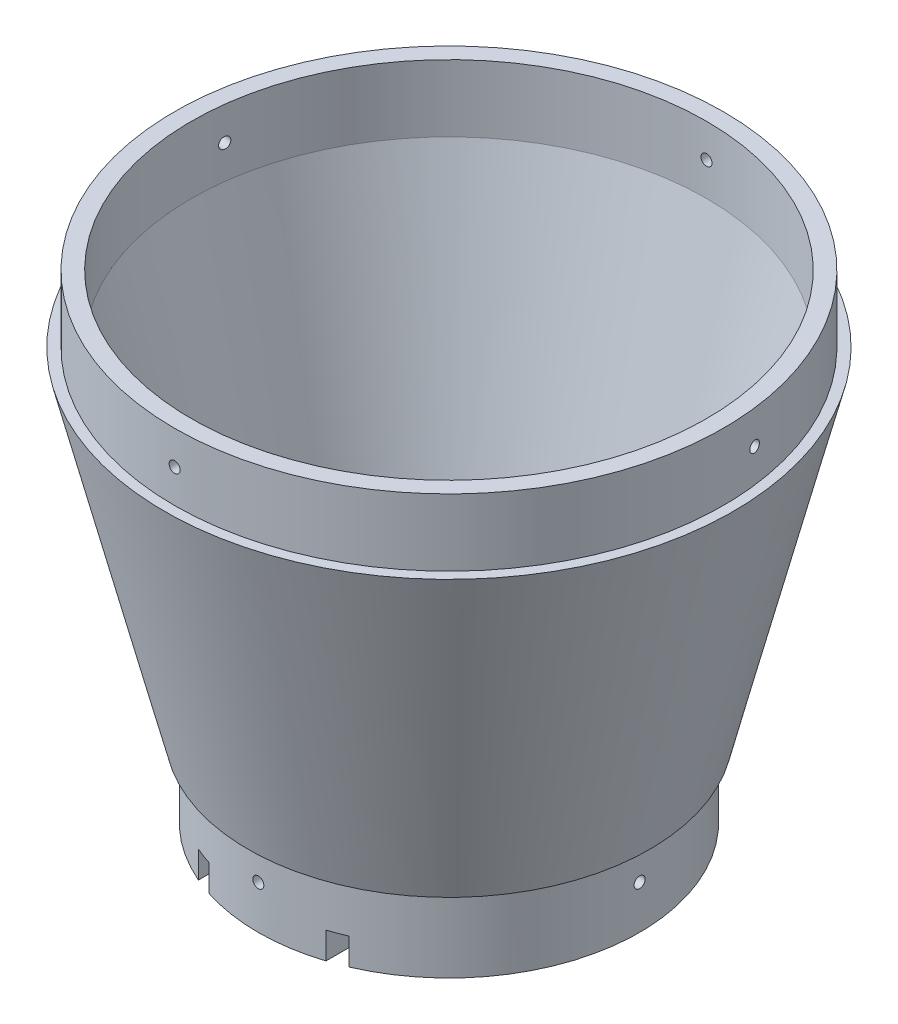
from build123d import *

# Parameters (mm, degrees)
BOSS_EXTRUDE1_REACH             = 171.853
SKETCH3_W                       = 15
SKETCH3_H                       = 10
BOSS_EXTRUDE1_DIRECTION_2_REACH = 171.853
CUT_EXTRUDE1_DEPTH              = 170.852877515
CUT_EXTRUDE1_DEPTH_BACK         = 170.852877515
SKETCH4_W                       = 5
SKETCH4_H                       = 8
M4_TAPPED_HOLE1_REACH           = 235.236
M4_TAPPED_HOLE1_BORE_R          = 1.65
M4_TAPPED_HOLE1_ON_FACE_2_REACH = 231.789
M4_TAPPED_HOLE1_BORE_2_R        = 1.65
M4_TAPPED_HOLE1_ON_FACE_3_REACH = 235.236
M4_TAPPED_HOLE1_BORE_3_R        = 1.65
M4_TAPPED_HOLE1_ON_FACE_4_REACH = 212.45
M4_TAPPED_HOLE1_BORE_4_R        = 1.65
M4_TAPPED_HOLE1_ON_FACE_5_REACH = 212.45
M4_TAPPED_HOLE1_BORE_5_R        = 1.65
M4_TAPPED_HOLE1_ON_FACE_6_REACH = 212.45
M4_TAPPED_HOLE1_BORE_6_R        = 1.65
M4_TAPPED_HOLE1_ON_FACE_7_REACH = 212.45
M4_TAPPED_HOLE1_BORE_7_R        = 1.65
M4_TAPPED_HOLE1_ON_FACE_8_REACH = 231.789
M4_TAPPED_HOLE1_BORE_8_R        = 1.65


with BuildPart() as part:
    # Sketch1 → Revolve1 (revolve)
    with BuildSketch(Plane.XY):
        Polygon((77, 120), (82, 120), (82, 100), (85, 100), (60, 0), (57, 0), (57, -23), (52, -23), (52, 0), (77, 100), align=None)
    revolve(axis=Axis((0, 0, 0), (0, 1, 0)))

    # Sketch3 → Boss-Extrude1 (add, up to next)
    with BuildSketch(Plane.XY, mode=Mode.PRIVATE) as boss_extrude1_sk1:
        with Locations((20, -18)):
            Rectangle(SKETCH3_W, SKETCH3_H)
    boss_extrude1_tool1 = extrude(boss_extrude1_sk1.sketch, amount=BOSS_EXTRUDE1_REACH, mode=Mode.PRIVATE) - part.part
    # Sketch3 → Boss-Extrude1 (add, up to next)
    with BuildSketch(Plane.XY, mode=Mode.PRIVATE) as boss_extrude1_sk2:
        with Locations((-20, -18)):
            Rectangle(SKETCH3_W, SKETCH3_H)
    boss_extrude1_tool2 = extrude(boss_extrude1_sk2.sketch, amount=BOSS_EXTRUDE1_REACH, mode=Mode.PRIVATE) - part.part
    add(boss_extrude1_tool1.solids().sort_by_distance((20, -18, 0))[0])
    add(boss_extrude1_tool2.solids().sort_by_distance((-20, -18, 0))[0])

    # Sketch3 → Boss-Extrude1 direction 2 (add, up to next)
    with BuildSketch(Plane.XY, mode=Mode.PRIVATE) as boss_extrude1_direction_2_sk1:
        with Locations((20, -18)):
            Rectangle(SKETCH3_W, SKETCH3_H)
    boss_extrude1_direction_2_tool1 = extrude(boss_extrude1_direction_2_sk1.sketch, amount=-BOSS_EXTRUDE1_DIRECTION_2_REACH, mode=Mode.PRIVATE) - part.part
    # Sketch3 → Boss-Extrude1 direction 2 (add, up to next)
    with BuildSketch(Plane.XY, mode=Mode.PRIVATE) as boss_extrude1_direction_2_sk2:
        with Locations((-20, -18)):
            Rectangle(SKETCH3_W, SKETCH3_H)
    boss_extrude1_direction_2_tool2 = extrude(boss_extrude1_direction_2_sk2.sketch, amount=-BOSS_EXTRUDE1_DIRECTION_2_REACH, mode=Mode.PRIVATE) - part.part
    add(boss_extrude1_direction_2_tool1.solids().sort_by_distance((20, -18, 0))[0])
    add(boss_extrude1_direction_2_tool2.solids().sort_by_distance((-20, -18, 0))[0])

    # Sketch4 → Cut-Extrude1 (cut, two sides: drawn at the far end of the back side and taken through both)
    with BuildSketch(Plane.XY.offset(-CUT_EXTRUDE1_DEPTH_BACK)):
        with Locations((-20, -19)):
            Rectangle(SKETCH4_W, SKETCH4_H)
        with Locations((20, -19)):
            Rectangle(SKETCH4_W, SKETCH4_H)
    extrude(amount=CUT_EXTRUDE1_DEPTH + CUT_EXTRUDE1_DEPTH_BACK, mode=Mode.SUBTRACT)

    # M4 Tapped Hole1 bore (on position points) → M4 Tapped Hole1 (cut, up to next)
    with BuildSketch(Plane(origin=(-81.387959798, 110, -10), x_dir=(0.121951219512, 0, -0.992536095092), z_dir=(-0.992536095092, 0, -0.121951219512)), mode=Mode.PRIVATE) as m4_tapped_hole1_sk1:
        Circle(M4_TAPPED_HOLE1_BORE_R)
    m4_tapped_hole1_tool1 = extrude(m4_tapped_hole1_sk1.sketch, amount=-M4_TAPPED_HOLE1_REACH, mode=Mode.PRIVATE) & part.part
    add(m4_tapped_hole1_tool1.solids().sort_by_distance((-81.38796, 110, -10))[0], mode=Mode.SUBTRACT)

    # M4 Tapped Hole1 bore 2 (on position points) → M4 Tapped Hole1 on face 2 (cut, up to next)
    with BuildSketch(Plane(origin=(0, 110, -82), x_dir=(-1, 0, 0), z_dir=(0, 0, -1)), mode=Mode.PRIVATE) as m4_tapped_hole1_on_face_2_sk1:
        Circle(M4_TAPPED_HOLE1_BORE_2_R)
    m4_tapped_hole1_on_face_2_tool1 = extrude(m4_tapped_hole1_on_face_2_sk1.sketch, amount=-M4_TAPPED_HOLE1_ON_FACE_2_REACH, mode=Mode.PRIVATE) & part.part
    add(m4_tapped_hole1_on_face_2_tool1.solids().sort_by_distance((0, 110, -82))[0], mode=Mode.SUBTRACT)

    # M4 Tapped Hole1 bore 3 (on position points) → M4 Tapped Hole1 on face 3 (cut, up to next)
    with BuildSketch(Plane(origin=(81.387959798, 110, -10), x_dir=(0.121951014775, 0, 0.992536120247), z_dir=(0.992536120247, 0, -0.121951014775)), mode=Mode.PRIVATE) as m4_tapped_hole1_on_face_3_sk1:
        Circle(M4_TAPPED_HOLE1_BORE_3_R)
    m4_tapped_hole1_on_face_3_tool1 = extrude(m4_tapped_hole1_on_face_3_sk1.sketch, amount=-M4_TAPPED_HOLE1_ON_FACE_3_REACH, mode=Mode.PRIVATE) & part.part
    add(m4_tapped_hole1_on_face_3_tool1.solids().sort_by_distance((81.38796, 110, -10))[0], mode=Mode.SUBTRACT)

    # M4 Tapped Hole1 bore 4 (on position points) → M4 Tapped Hole1 on face 4 (cut, up to next)
    with BuildSketch(Plane(origin=(-57, -10, 0), x_dir=(0, 0, -1), z_dir=(-1, 0, 0)), mode=Mode.PRIVATE) as m4_tapped_hole1_on_face_4_sk1:
        Circle(M4_TAPPED_HOLE1_BORE_4_R)
    m4_tapped_hole1_on_face_4_tool1 = extrude(m4_tapped_hole1_on_face_4_sk1.sketch, amount=-M4_TAPPED_HOLE1_ON_FACE_4_REACH, mode=Mode.PRIVATE) & part.part
    add(m4_tapped_hole1_on_face_4_tool1.solids().sort_by_distance((-57, -10, 0))[0], mode=Mode.SUBTRACT)

    # M4 Tapped Hole1 bore 5 (on position points) → M4 Tapped Hole1 on face 5 (cut, up to next)
    with BuildSketch(Plane(origin=(0, -10, 57), x_dir=(1, 0, 0), z_dir=(0, 0, 1)), mode=Mode.PRIVATE) as m4_tapped_hole1_on_face_5_sk1:
        Circle(M4_TAPPED_HOLE1_BORE_5_R)
    m4_tapped_hole1_on_face_5_tool1 = extrude(m4_tapped_hole1_on_face_5_sk1.sketch, amount=-M4_TAPPED_HOLE1_ON_FACE_5_REACH, mode=Mode.PRIVATE) & part.part
    add(m4_tapped_hole1_on_face_5_tool1.solids().sort_by_distance((0, -10, 57))[0], mode=Mode.SUBTRACT)

    # M4 Tapped Hole1 bore 6 (on position points) → M4 Tapped Hole1 on face 6 (cut, up to next)
    with BuildSketch(Plane(origin=(57, -10, 0), x_dir=(0, 0, 1), z_dir=(1, 0, 0)), mode=Mode.PRIVATE) as m4_tapped_hole1_on_face_6_sk1:
        Circle(M4_TAPPED_HOLE1_BORE_6_R)
    m4_tapped_hole1_on_face_6_tool1 = extrude(m4_tapped_hole1_on_face_6_sk1.sketch, amount=-M4_TAPPED_HOLE1_ON_FACE_6_REACH, mode=Mode.PRIVATE) & part.part
    add(m4_tapped_hole1_on_face_6_tool1.solids().sort_by_distance((57, -10, 0))[0], mode=Mode.SUBTRACT)

    # M4 Tapped Hole1 bore 7 (on position points) → M4 Tapped Hole1 on face 7 (cut, up to next)
    with BuildSketch(Plane(origin=(0, -10, -57), x_dir=(-1, 0, 0), z_dir=(0, 0, -1)), mode=Mode.PRIVATE) as m4_tapped_hole1_on_face_7_sk1:
        Circle(M4_TAPPED_HOLE1_BORE_7_R)
    m4_tapped_hole1_on_face_7_tool1 = extrude(m4_tapped_hole1_on_face_7_sk1.sketch, amount=-M4_TAPPED_HOLE1_ON_FACE_7_REACH, mode=Mode.PRIVATE) & part.part
    add(m4_tapped_hole1_on_face_7_tool1.solids().sort_by_distance((0, -10, -57))[0], mode=Mode.SUBTRACT)

    # M4 Tapped Hole1 bore 8 (on position points) → M4 Tapped Hole1 on face 8 (cut, up to next)
    with BuildSketch(Plane(origin=(0, 110, 82), x_dir=(1, 0, 0), z_dir=(0, 0, 1)), mode=Mode.PRIVATE) as m4_tapped_hole1_on_face_8_sk1:
        Circle(M4_TAPPED_HOLE1_BORE_8_R)
    m4_tapped_hole1_on_face_8_tool1 = extrude(m4_tapped_hole1_on_face_8_sk1.sketch, amount=-M4_TAPPED_HOLE1_ON_FACE_8_REACH, mode=Mode.PRIVATE) & part.part
    add(m4_tapped_hole1_on_face_8_tool1.solids().sort_by_distance((0, 110, 82))[0], mode=Mode.SUBTRACT)


solid = part.part
